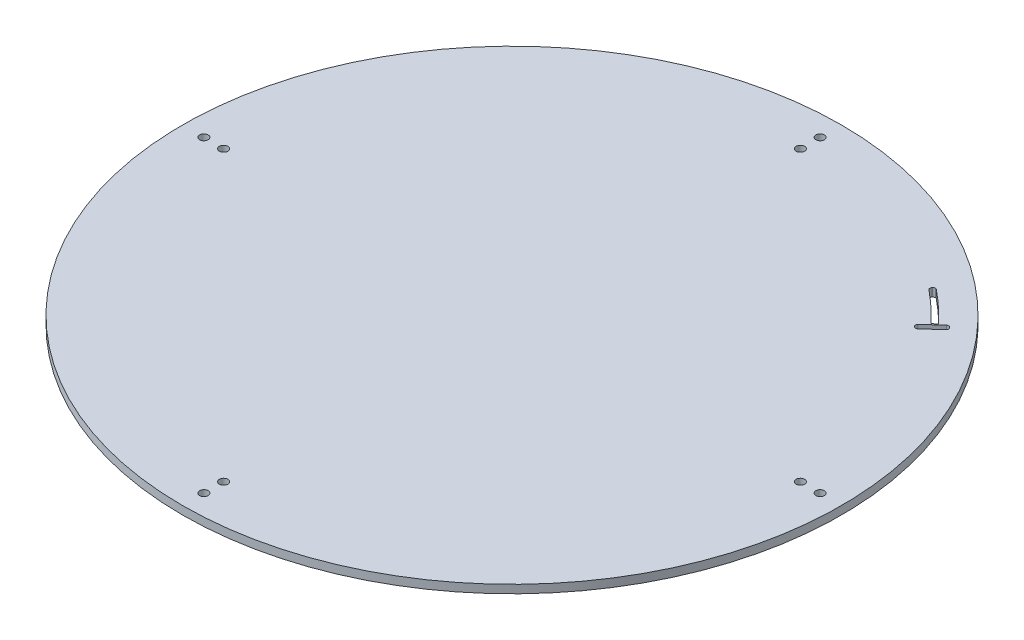
from build123d import *

# Parameters (mm, degrees)
SKETCH_1_R               = 200
EXTRUDE_257_DEPTH        = 5
CUT_EXTRUDE_3_REACH      = 284.887
SKETCH_2_R               = 2.6
PATTERN_CIRCULAR_1_COUNT = 4
SKETCH_4_W               = 3.2
SKETCH_4_H               = 12.2
CUT_REVOLVE_3_ANGLE      = 8.5
FILLET_2_R               = 1.5
CUT_EXTRUDE_1561_REACH   = 284.887
FILLET_1_R               = 1.5


with BuildPart() as part:
    # 草图1 → Extrude 257 (new body)
    with BuildSketch(Plane(origin=(0, 0, 0), x_dir=(1, 0, 0), z_dir=(0, 1, 0))):
        Circle(SKETCH_1_R)
    extrude(amount=EXTRUDE_257_DEPTH)

    # 草图2 → 切除-拉伸3 (cut, up to next)
    with BuildSketch(Plane(origin=(0, 5, 0), x_dir=(1, 0, 0), z_dir=(0, 1, 0)), mode=Mode.PRIVATE) as cut_extrude_3_sk1:
        with Locations((0, -175)):
            Circle(SKETCH_2_R)
    cut_extrude_3_tool1 = extrude(cut_extrude_3_sk1.sketch, amount=-CUT_EXTRUDE_3_REACH, mode=Mode.PRIVATE) & part.part
    # 草图2 → 切除-拉伸3 (cut, up to next)
    with BuildSketch(Plane(origin=(0, 5, 0), x_dir=(1, 0, 0), z_dir=(0, 1, 0)), mode=Mode.PRIVATE) as cut_extrude_3_sk2:
        with Locations((0, -187)):
            Circle(SKETCH_2_R)
    cut_extrude_3_tool2 = extrude(cut_extrude_3_sk2.sketch, amount=-CUT_EXTRUDE_3_REACH, mode=Mode.PRIVATE) & part.part
    cut_extrude_3_1 = cut_extrude_3_tool1.solids().sort_by_distance((0, 5, 175))[0]
    add(cut_extrude_3_1, mode=Mode.SUBTRACT)
    cut_extrude_3_2 = cut_extrude_3_tool2.solids().sort_by_distance((0, 5, 187))[0]
    add(cut_extrude_3_2, mode=Mode.SUBTRACT)
    cut_extrude_3 = cut_extrude_3_1 + cut_extrude_3_2  # 切除-拉伸3 as one shape, for the pattern or mirror that repeats it

    # 阵列(圆周)1: 切除-拉伸3 ×4 about axis
    pattern_circular_1_axis = Axis((0, -55, 0), (0, 1, 0))
    for i in range(1, PATTERN_CIRCULAR_1_COUNT):
        add(cut_extrude_3.rotate(pattern_circular_1_axis, i * 360 / PATTERN_CIRCULAR_1_COUNT), mode=Mode.SUBTRACT)

    # 草图4 → 切除-旋转3 (revolve, cut)
    with BuildSketch(Plane(origin=(0, 0, 0), x_dir=(0.73135370161917, 0, -0.6819983600624991), z_dir=(0.6819983600624991, 0, 0.73135370161917))):
        with Locations((181.5, 3)):
            Rectangle(SKETCH_4_W, SKETCH_4_H)
    revolve(axis=Axis((0, -55, 0), (0, 1, 0)), revolution_arc=CUT_REVOLVE_3_ANGLE, mode=Mode.SUBTRACT)

    # 圆角2
    fillet_2_edges = [part.edges().sort_by_distance(p)[0] for p in [
        (111.990383131, 2.5, -140.791207418),
        (113.982429968, 2.5, -143.29555352),
    ]]
    fillet(fillet_2_edges, radius=FILLET_2_R)

    # 草图6 → Cut-Extrude 1561 (cut, up to next)
    with BuildSketch(Plane(origin=(0, 5, 0), x_dir=(1, 0, 0), z_dir=(0, 1, 0)), mode=Mode.PRIVATE) as cut_extrude_1561_sk1:
        with BuildLine():
            Line((126.949424115, 117.373773312), (138.051570376, 127.626593202))
            ThreePointArc((138.051570376, 127.626593202), (139.227272555, 126.342985371), (140.391040179, 125.048547425))
            Line((140.391040179, 125.048547425), (129.111648449, 114.991048258))
            ThreePointArc((129.111648449, 114.991048258), (128.036079154, 116.187440713), (126.949424115, 117.373773312))
        make_face()
    cut_extrude_1561_tool1 = extrude(cut_extrude_1561_sk1.sketch, amount=-CUT_EXTRUDE_1561_REACH, mode=Mode.PRIVATE) & part.part
    add(cut_extrude_1561_tool1.solids().sort_by_distance((133.703195, 5, -121.330114))[0], mode=Mode.SUBTRACT)

    # 圆角1
    fillet_1_edges = [part.edges().sort_by_distance(p)[0] for p in [
        (129.111648449, 2.5, -114.991048258),
        (140.391040179, 2.5, -125.048547425),
        (138.051570376, 2.5, -127.626593202),
        (126.949424115, 2.5, -117.373773312),
    ]]
    fillet(fillet_1_edges, radius=FILLET_1_R)


solid = part.part
